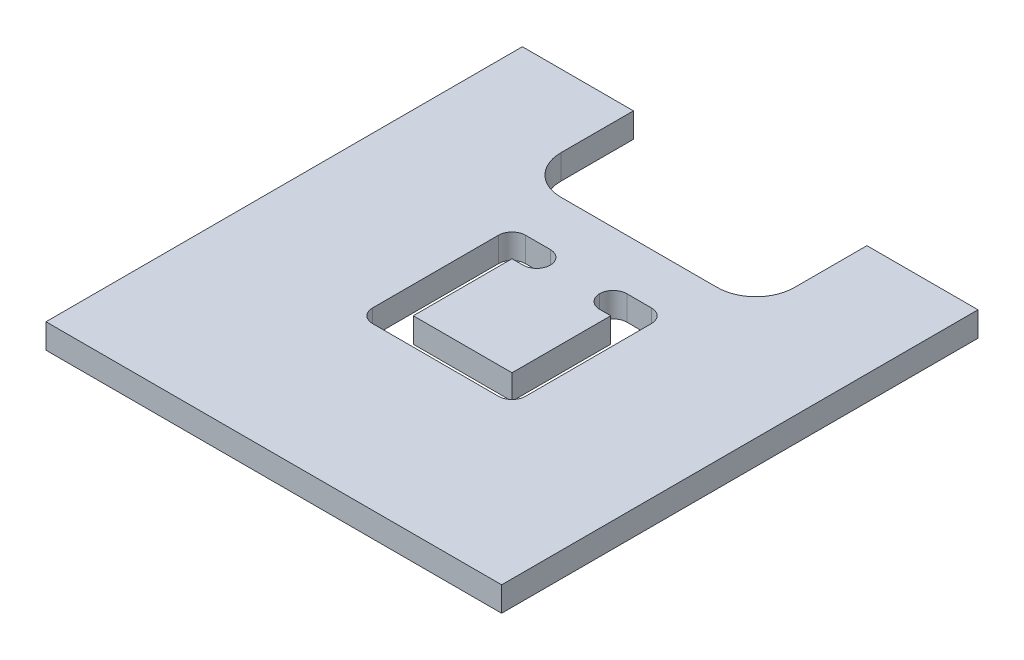
from build123d import *

# Parameters (mm, degrees)
SKETCH_1_W          = 18.46
SKETCH_1_H          = 19.3
EXTRUDE_1_DEPTH     = 1
SKETCH_2_W          = 9.46
SKETCH_2_H          = 4.5
CUT_EXTRUDE_1_DEPTH = 14.390870024
FILLET_1_R          = 1.56
CUT_EXTRUDE_2_DEPTH = 14.390870024
FILLET_7_R          = 0.55


with BuildPart() as part:
    # 草图1 → 凸台-拉伸1 (new body)
    with BuildSketch(Plane(origin=(0, 0, 0), x_dir=(1, 0, 0), z_dir=(0, 1, 0))):
        Rectangle(SKETCH_1_W, SKETCH_1_H)
    extrude(amount=EXTRUDE_1_DEPTH)

    # 草图2 → 切除-拉伸1 (cut, through all)
    with BuildSketch(Plane.XZ):
        with Locations((0, -7.4)):
            Rectangle(SKETCH_2_W, SKETCH_2_H)
    extrude(amount=-CUT_EXTRUDE_1_DEPTH, mode=Mode.SUBTRACT)

    # 圆角1
    fillet_1_edges = [part.edges().sort_by_distance(p)[0] for p in [
        (4.73, 0.5, -5.15),
        (-4.73, 0.5, -5.15),
    ]]
    fillet(fillet_1_edges, radius=FILLET_1_R)

    # 草图3 → 切除-拉伸2 (cut, through all)
    with BuildSketch(Plane(origin=(0, 1, 0), x_dir=(1, 0, 0), z_dir=(0, 1, 0))):
        Polygon((1, 3.1), (3.1, 3.1), (3.1, -3.1), (-3.1, -3.1), (-3.1, 3.1), (-1, 3.1), (-1, 2), (-2, 2), (-2, -2), (2, -2), (2, 2), (1, 2), align=None)
    extrude(amount=-CUT_EXTRUDE_2_DEPTH, mode=Mode.SUBTRACT)

    # 圆角7
    fillet_7_edges = [part.edges().sort_by_distance(p)[0] for p in [
        (-1, 0.5, -2),
        (1, 0.5, -2),
        (-3.1, 0.5, 3.1),
        (-1, 0.5, -3.1),
        (-3.1, 0.5, -3.1),
        (1, 0.5, -3.1),
        (3.1, 0.5, -3.1),
        (3.1, 0.5, 3.1),
    ]]
    fillet(fillet_7_edges, radius=FILLET_7_R - 0.0001)  # a hair under: the kernel refuses the full size


solid = part.part
